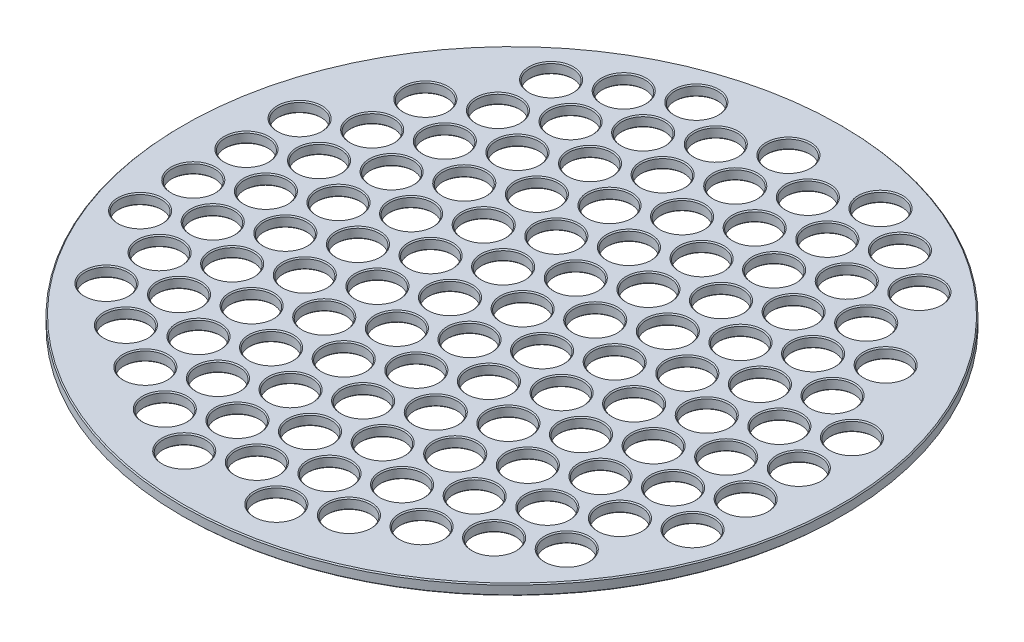
from build123d import *

# Parameters (mm, degrees)
SKETCH_1_R          = 62
EXTRUDE_1_DEPTH     = 2
SKETCH_2_R          = 4
CUT_EXTRUDE_1_DEPTH = 88.704047797
OTHER_1_OUTLINE_R   = 4
OTHER_1_DEPTH       = 2
CHAMFER_1_SIZE      = 0.2


# Read off the part's stored shape, not the designer's step: 填充阵列1
with BuildPart() as part:
    # 草图1 → 凸台-拉伸1 (new body)
    with BuildSketch(Plane(origin=(0, 0, 0), x_dir=(1, 0, 0), z_dir=(0, 1, 0))):
        with Locations(Location((0, 0, 0), (0, 0, 270))):
            Circle(SKETCH_1_R)
    extrude(amount=EXTRUDE_1_DEPTH)

    # 草图2 → 切除-拉伸1 (cut, through all)
    with BuildSketch(Plane(origin=(0, 2, 0), x_dir=(1, 0, 0), z_dir=(0, 1, 0))):
        with Locations(Location((0, 52, 0), (0, 0, 270))):
            Circle(SKETCH_2_R)
    extrude(amount=-CUT_EXTRUDE_1_DEPTH, mode=Mode.SUBTRACT)

    # 填充阵列1 outline → 填充阵列1 (cut)
    with BuildSketch(Plane(origin=(0, 0, 0), x_dir=(1, 0, 0), z_dir=(0, 1, 0))):
        with Locations((17.320508076, 52)):
            Circle(OTHER_1_OUTLINE_R)
        with Locations((0, -28)):
            Circle(OTHER_1_OUTLINE_R)
        with Locations((-8.660254038, -23)):
            Circle(OTHER_1_OUTLINE_R)
        with Locations((-17.320508076, -18)):
            Circle(OTHER_1_OUTLINE_R)
        with Locations((-25.980762114, -13)):
            Circle(OTHER_1_OUTLINE_R)
        with Locations((34.641016151, -38)):
            Circle(OTHER_1_OUTLINE_R)
        with Locations((-51.961524227, 2)):
            Circle(OTHER_1_OUTLINE_R)
        with Locations((-43.301270189, -3)):
            Circle(OTHER_1_OUTLINE_R)
        with Locations((-34.641016151, -8)):
            Circle(OTHER_1_OUTLINE_R)
        with Locations((-17.320508076, -28)):
            Circle(OTHER_1_OUTLINE_R)
        with Locations((-25.980762114, -23)):
            Circle(OTHER_1_OUTLINE_R)
        with Locations((-34.641016151, -18)):
            Circle(OTHER_1_OUTLINE_R)
        with Locations((-43.301270189, -13)):
            Circle(OTHER_1_OUTLINE_R)
        with Locations((8.660254038, -33)):
            Circle(OTHER_1_OUTLINE_R)
        with Locations((17.320508076, -38)):
            Circle(OTHER_1_OUTLINE_R)
        with Locations((25.980762114, -43)):
            Circle(OTHER_1_OUTLINE_R)
        with Locations((-51.961524227, -8)):
            Circle(OTHER_1_OUTLINE_R)
        with Locations((-43.301270189, 7)):
            Circle(OTHER_1_OUTLINE_R)
        with Locations((-51.961524227, 12)):
            Circle(OTHER_1_OUTLINE_R)
        with Locations((43.301270189, -33)):
            Circle(OTHER_1_OUTLINE_R)
        with Locations((34.641016151, -28)):
            Circle(OTHER_1_OUTLINE_R)
        with Locations((25.980762114, -23)):
            Circle(OTHER_1_OUTLINE_R)
        with Locations((17.320508076, -18)):
            Circle(OTHER_1_OUTLINE_R)
        with Locations((8.660254038, -13)):
            Circle(OTHER_1_OUTLINE_R)
        with Locations((0, -8)):
            Circle(OTHER_1_OUTLINE_R)
        with Locations((-34.641016151, 2)):
            Circle(OTHER_1_OUTLINE_R)
        with Locations((-25.980762114, -3)):
            Circle(OTHER_1_OUTLINE_R)
        with Locations((-17.320508076, -8)):
            Circle(OTHER_1_OUTLINE_R)
        with Locations((-8.660254038, -13)):
            Circle(OTHER_1_OUTLINE_R)
        with Locations((0, -18)):
            Circle(OTHER_1_OUTLINE_R)
        with Locations((8.660254038, -23)):
            Circle(OTHER_1_OUTLINE_R)
        with Locations((17.320508076, -28)):
            Circle(OTHER_1_OUTLINE_R)
        with Locations((25.980762114, -33)):
            Circle(OTHER_1_OUTLINE_R)
        with Locations((-8.660254038, -53)):
            Circle(OTHER_1_OUTLINE_R)
        with Locations((-8.660254038, -33)):
            Circle(OTHER_1_OUTLINE_R)
        with Locations((0, -38)):
            Circle(OTHER_1_OUTLINE_R)
        with Locations((8.660254038, -43)):
            Circle(OTHER_1_OUTLINE_R)
        with Locations((17.320508076, -48)):
            Circle(OTHER_1_OUTLINE_R)
        with Locations((-51.961524227, -18)):
            Circle(OTHER_1_OUTLINE_R)
        with Locations((-43.301270189, -23)):
            Circle(OTHER_1_OUTLINE_R)
        with Locations((-34.641016151, -28)):
            Circle(OTHER_1_OUTLINE_R)
        with Locations((-25.980762114, -33)):
            Circle(OTHER_1_OUTLINE_R)
        with Locations((-17.320508076, -48)):
            Circle(OTHER_1_OUTLINE_R)
        with Locations((-25.980762114, -43)):
            Circle(OTHER_1_OUTLINE_R)
        with Locations((-34.641016151, -38)):
            Circle(OTHER_1_OUTLINE_R)
        with Locations((-43.301270189, -33)):
            Circle(OTHER_1_OUTLINE_R)
        with Locations((8.660254038, -53)):
            Circle(OTHER_1_OUTLINE_R)
        with Locations((0, -48)):
            Circle(OTHER_1_OUTLINE_R)
        with Locations((-8.660254038, -43)):
            Circle(OTHER_1_OUTLINE_R)
        with Locations((-17.320508076, -38)):
            Circle(OTHER_1_OUTLINE_R)
        with Locations((-25.980762114, 47)):
            Circle(OTHER_1_OUTLINE_R)
        with Locations((-17.320508076, 42)):
            Circle(OTHER_1_OUTLINE_R)
        with Locations((-8.660254038, 37)):
            Circle(OTHER_1_OUTLINE_R)
        with Locations((0, 32)):
            Circle(OTHER_1_OUTLINE_R)
        with Locations((8.660254038, 27)):
            Circle(OTHER_1_OUTLINE_R)
        with Locations((17.320508076, 22)):
            Circle(OTHER_1_OUTLINE_R)
        with Locations((25.980762114, 17)):
            Circle(OTHER_1_OUTLINE_R)
        with Locations((34.641016151, 12)):
            Circle(OTHER_1_OUTLINE_R)
        with Locations((8.660254038, 17)):
            Circle(OTHER_1_OUTLINE_R)
        with Locations((0, 22)):
            Circle(OTHER_1_OUTLINE_R)
        with Locations((-8.660254038, 27)):
            Circle(OTHER_1_OUTLINE_R)
        with Locations((-17.320508076, 32)):
            Circle(OTHER_1_OUTLINE_R)
        with Locations((-25.980762114, 37)):
            Circle(OTHER_1_OUTLINE_R)
        with Locations((-34.641016151, 42)):
            Circle(OTHER_1_OUTLINE_R)
        with Locations((51.961524227, 2)):
            Circle(OTHER_1_OUTLINE_R)
        with Locations((43.301270189, 7)):
            Circle(OTHER_1_OUTLINE_R)
        with Locations((25.980762114, 37)):
            Circle(OTHER_1_OUTLINE_R)
        with Locations((34.641016151, 32)):
            Circle(OTHER_1_OUTLINE_R)
        with Locations((43.301270189, 27)):
            Circle(OTHER_1_OUTLINE_R)
        with Locations((-17.320508076, 52)):
            Circle(OTHER_1_OUTLINE_R)
        with Locations((17.320508076, 42)):
            Circle(OTHER_1_OUTLINE_R)
        with Locations((8.660254038, 47)):
            Circle(OTHER_1_OUTLINE_R)
        with Locations((34.641016151, 42)):
            Circle(OTHER_1_OUTLINE_R)
        with Locations((25.980762114, 47)):
            Circle(OTHER_1_OUTLINE_R)
        with Locations((-8.660254038, 47)):
            Circle(OTHER_1_OUTLINE_R)
        with Locations((0, 42)):
            Circle(OTHER_1_OUTLINE_R)
        with Locations((8.660254038, 37)):
            Circle(OTHER_1_OUTLINE_R)
        with Locations((17.320508076, 32)):
            Circle(OTHER_1_OUTLINE_R)
        with Locations((25.980762114, 27)):
            Circle(OTHER_1_OUTLINE_R)
        with Locations((34.641016151, 22)):
            Circle(OTHER_1_OUTLINE_R)
        with Locations((43.301270189, 17)):
            Circle(OTHER_1_OUTLINE_R)
        with Locations((51.961524227, 12)):
            Circle(OTHER_1_OUTLINE_R)
        with Locations((-43.301270189, 27)):
            Circle(OTHER_1_OUTLINE_R)
        with Locations((-34.641016151, 22)):
            Circle(OTHER_1_OUTLINE_R)
        with Locations((-25.980762114, 17)):
            Circle(OTHER_1_OUTLINE_R)
        with Locations((-17.320508076, 12)):
            Circle(OTHER_1_OUTLINE_R)
        with Locations((-8.660254038, 7)):
            Circle(OTHER_1_OUTLINE_R)
        with Locations((0, 2)):
            Circle(OTHER_1_OUTLINE_R)
        with Locations((8.660254038, -3)):
            Circle(OTHER_1_OUTLINE_R)
        with Locations((17.320508076, -8)):
            Circle(OTHER_1_OUTLINE_R)
        with Locations((-8.660254038, -3)):
            Circle(OTHER_1_OUTLINE_R)
        with Locations((-17.320508076, 2)):
            Circle(OTHER_1_OUTLINE_R)
        with Locations((-25.980762114, 7)):
            Circle(OTHER_1_OUTLINE_R)
        with Locations((-34.641016151, 12)):
            Circle(OTHER_1_OUTLINE_R)
        with Locations((25.980762114, -13)):
            Circle(OTHER_1_OUTLINE_R)
        with Locations((34.641016151, -18)):
            Circle(OTHER_1_OUTLINE_R)
        with Locations((43.301270189, -23)):
            Circle(OTHER_1_OUTLINE_R)
        with Locations((-43.301270189, 17)):
            Circle(OTHER_1_OUTLINE_R)
        with Locations((51.961524227, -8)):
            Circle(OTHER_1_OUTLINE_R)
        with Locations((-34.641016151, 32)):
            Circle(OTHER_1_OUTLINE_R)
        with Locations((-25.980762114, 27)):
            Circle(OTHER_1_OUTLINE_R)
        with Locations((-17.320508076, 22)):
            Circle(OTHER_1_OUTLINE_R)
        with Locations((43.301270189, -3)):
            Circle(OTHER_1_OUTLINE_R)
        with Locations((34.641016151, 2)):
            Circle(OTHER_1_OUTLINE_R)
        with Locations((25.980762114, 7)):
            Circle(OTHER_1_OUTLINE_R)
        with Locations((17.320508076, 12)):
            Circle(OTHER_1_OUTLINE_R)
        with Locations((-8.660254038, 17)):
            Circle(OTHER_1_OUTLINE_R)
        with Locations((0, 12)):
            Circle(OTHER_1_OUTLINE_R)
        with Locations((8.660254038, 7)):
            Circle(OTHER_1_OUTLINE_R)
        with Locations((17.320508076, 2)):
            Circle(OTHER_1_OUTLINE_R)
        with Locations((25.980762114, -3)):
            Circle(OTHER_1_OUTLINE_R)
        with Locations((34.641016151, -8)):
            Circle(OTHER_1_OUTLINE_R)
        with Locations((43.301270189, -13)):
            Circle(OTHER_1_OUTLINE_R)
        with Locations((51.961524227, -18)):
            Circle(OTHER_1_OUTLINE_R)
    extrude(amount=OTHER_1_DEPTH, mode=Mode.SUBTRACT)

    # 倒角1
    chamfer_1_edges = [part.edges().sort_by_distance(p)[0] for p in [
        (47.961524227, 0, 18),
        (47.961524227, 2, 18),
        (39.301270189, 0, 13),
        (39.301270189, 2, 13),
        (30.641016151, 0, 8),
        (30.641016151, 2, 8),
        (21.980762114, 0, 3),
        (21.980762114, 2, 3),
        (13.320508076, 0, -2),
        (13.320508076, 2, -2),
        (4.660254038, 0, -7),
        (4.660254038, 2, -7),
        (-4, 0, -12),
        (-4, 2, -12),
        (-12.660254038, 0, -17),
        (-12.660254038, 2, -17),
        (13.320508076, 0, -12),
        (13.320508076, 2, -12),
        (21.980762114, 0, -7),
        (21.980762114, 2, -7),
        (30.641016151, 0, -2),
        (30.641016151, 2, -2),
        (39.301270189, 0, 3),
        (39.301270189, 2, 3),
        (-21.320508076, 0, -22),
        (-21.320508076, 2, -22),
        (-29.980762114, 0, -27),
        (-29.980762114, 2, -27),
        (-38.641016151, 0, -32),
        (-38.641016151, 2, -32),
        (47.961524227, 0, 8),
        (47.961524227, 2, 8),
        (-47.301270189, 0, -17),
        (-47.301270189, 2, -17),
        (39.301270189, 0, 23),
        (39.301270189, 2, 23),
        (30.641016151, 0, 18),
        (30.641016151, 2, 18),
        (21.980762114, 0, 13),
        (21.980762114, 2, 13),
        (-38.641016151, 0, -12),
        (-38.641016151, 2, -12),
        (-29.980762114, 0, -7),
        (-29.980762114, 2, -7),
        (-21.320508076, 0, -2),
        (0, 0, -62),
        (-21.320508076, 2, -2),
        (-12.660254038, 0, 3),
        (-12.660254038, 2, 3),
        (13.320508076, 0, 8),
        (13.320508076, 2, 8),
        (4.660254038, 0, 3),
        (4.660254038, 2, 3),
        (-4, 0, -2),
        (-4, 2, -2),
        (-12.660254038, 0, -7),
        (-12.660254038, 2, -7),
        (-21.320508076, 0, -12),
        (-21.320508076, 2, -12),
        (-29.980762114, 0, -17),
        (-29.980762114, 2, -17),
        (-38.641016151, 0, -22),
        (-38.641016151, 2, -22),
        (-47.301270189, 0, -27),
        (-47.301270189, 2, -27),
        (47.961524227, 0, -12),
        (47.961524227, 2, -12),
        (39.301270189, 0, -17),
        (39.301270189, 2, -17),
        (30.641016151, 0, -22),
        (30.641016151, 2, -22),
        (21.980762114, 0, -27),
        (21.980762114, 2, -27),
        (13.320508076, 0, -32),
        (13.320508076, 2, -32),
        (4.660254038, 0, -37),
        (4.660254038, 2, -37),
        (-4, 0, -42),
        (-4, 2, -42),
        (-12.660254038, 0, -47),
        (-12.660254038, 2, -47),
        (21.980762114, 0, -47),
        (21.980762114, 2, -47),
        (30.641016151, 0, -42),
        (30.641016151, 2, -42),
        (4.660254038, 0, -47),
        (4.660254038, 2, -47),
        (13.320508076, 0, -42),
        (13.320508076, 2, -42),
        (-21.320508076, 0, -52),
        (-21.320508076, 2, -52),
        (39.301270189, 0, -27),
        (39.301270189, 2, -27),
        (30.641016151, 0, -32),
        (30.641016151, 2, -32),
        (21.980762114, 0, -37),
        (21.980762114, 2, -37),
        (39.301270189, 0, -7),
        (39.301270189, 2, -7),
        (47.961524227, 0, -2),
        (47.961524227, 2, -2),
        (-38.641016151, 0, -42),
        (-38.641016151, 2, -42),
        (-29.980762114, 0, -37),
        (-29.980762114, 2, -37),
        (-21.320508076, 0, -32),
        (-21.320508076, 2, -32),
        (-12.660254038, 0, -27),
        (-12.660254038, 2, -27),
        (-4, 0, -22),
        (-4, 2, -22),
        (4.660254038, 0, -17),
        (4.660254038, 2, -17),
        (30.641016151, 0, -12),
        (30.641016151, 2, -12),
        (21.980762114, 0, -17),
        (21.980762114, 2, -17),
        (13.320508076, 0, -22),
        (13.320508076, 2, -22),
        (4.660254038, 0, -27),
        (4.660254038, 2, -27),
        (-4, 0, -32),
        (-4, 2, -32),
        (-12.660254038, 0, -37),
        (-12.660254038, 2, -37),
        (-21.320508076, 0, -42),
        (-21.320508076, 2, -42),
        (-29.980762114, 0, -47),
        (-29.980762114, 2, -47),
        (-21.320508076, 0, 38),
        (-21.320508076, 2, 38),
        (-12.660254038, 0, 43),
        (-12.660254038, 2, 43),
        (-4, 0, 48),
        (-4, 2, 48),
        (4.660254038, 0, 53),
        (4.660254038, 2, 53),
        (-47.301270189, 0, 33),
        (-47.301270189, 2, 33),
        (-38.641016151, 0, 38),
        (-38.641016151, 2, 38),
        (-29.980762114, 0, 43),
        (-29.980762114, 2, 43),
        (-21.320508076, 0, 48),
        (-21.320508076, 2, 48),
        (-29.980762114, 0, 33),
        (-29.980762114, 2, 33),
        (-38.641016151, 0, 28),
        (-38.641016151, 2, 28),
        (-47.301270189, 0, 23),
        (-47.301270189, 2, 23),
        (-55.961524227, 0, 18),
        (-55.961524227, 2, 18),
        (13.320508076, 0, 48),
        (13.320508076, 2, 48),
        (4.660254038, 0, 43),
        (4.660254038, 2, 43),
        (-4, 0, 38),
        (-4, 2, 38),
        (-12.660254038, 0, 33),
        (-12.660254038, 2, 33),
        (-12.660254038, 0, 53),
        (-12.660254038, 2, 53),
        (21.980762114, 0, 33),
        (21.980762114, 2, 33),
        (13.320508076, 0, 28),
        (13.320508076, 2, 28),
        (4.660254038, 0, 23),
        (4.660254038, 2, 23),
        (-4, 0, 18),
        (-4, 2, 18),
        (-12.660254038, 0, 13),
        (-12.660254038, 2, 13),
        (-21.320508076, 0, 8),
        (-21.320508076, 2, 8),
        (-29.980762114, 0, 3),
        (-29.980762114, 2, 3),
        (-38.641016151, 0, -2),
        (-38.641016151, 2, -2),
        (-4, 0, 8),
        (-4, 2, 8),
        (4.660254038, 0, 13),
        (4.660254038, 2, 13),
        (13.320508076, 0, 18),
        (13.320508076, 2, 18),
        (21.980762114, 0, 23),
        (21.980762114, 2, 23),
        (30.641016151, 0, 28),
        (30.641016151, 2, 28),
        (39.301270189, 0, 33),
        (39.301270189, 2, 33),
        (-55.961524227, 0, -12),
        (-55.961524227, 2, -12),
        (-47.301270189, 0, -7),
        (-47.301270189, 2, -7),
        (-55.961524227, 0, 8),
        (-55.961524227, 2, 8),
        (21.980762114, 0, 43),
        (21.980762114, 2, 43),
        (13.320508076, 0, 38),
        (13.320508076, 2, 38),
        (4.660254038, 0, 33),
        (4.660254038, 2, 33),
        (-47.301270189, 0, 13),
        (-47.301270189, 2, 13),
        (-38.641016151, 0, 18),
        (-38.641016151, 2, 18),
        (-29.980762114, 0, 23),
        (-29.980762114, 2, 23),
        (-21.320508076, 0, 28),
        (-21.320508076, 2, 28),
        (-38.641016151, 0, 8),
        (-38.641016151, 2, 8),
        (-47.301270189, 0, 3),
        (-47.301270189, 2, 3),
        (-55.961524227, 0, -2),
        (-55.961524227, 2, -2),
        (30.641016151, 0, 38),
        (30.641016151, 2, 38),
        (-29.980762114, 0, 13),
        (-29.980762114, 2, 13),
        (-21.320508076, 0, 18),
        (-21.320508076, 2, 18),
        (-12.660254038, 0, 23),
        (-12.660254038, 2, 23),
        (-4, 0, 28),
        (-4, 2, 28),
        (13.320508076, 0, -52),
        (13.320508076, 2, -52),
        (0, 2, -62),
        (0, 0, -56),
        (0, 2, -56),
    ]]
    chamfer(chamfer_1_edges, length=CHAMFER_1_SIZE)


solid = part.part
